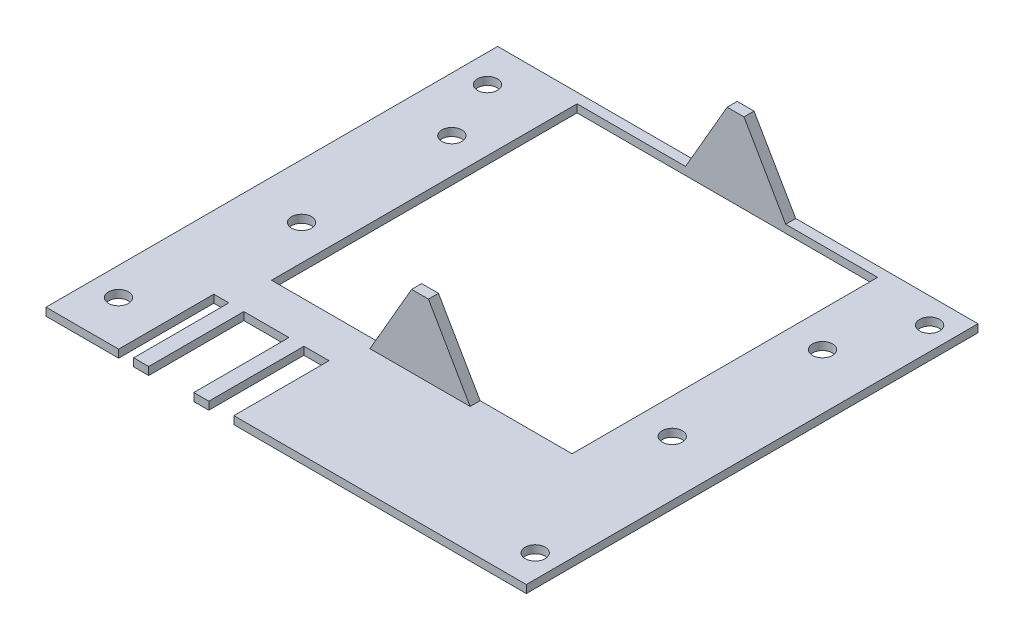
from build123d import *

# Parameters (mm, degrees)
SKETCH1_W               = 96.89
SKETCH1_H               = 90.17
PCB_DEPTH               = 1.57
SKETCH2_R               = 2
M3_MOUNTING_HOLES_DEPTH = 1.57
SKETCH4_R               = 2
CUT_EXTRUDE1_DEPTH      = 23
BOSS_EXTRUDE2_DEPTH     = 2
BOSS_EXTRUDE3_DEPTH     = 2
SKETCH9_W               = 3
SKETCH9_H               = 19
SKETCH9_W_2             = 9
SKETCH9_W_3             = 5
CUT_EXTRUDE2_DEPTH      = 128.304608561
SKETCH10_W              = 0.5
SKETCH10_H              = 90.17
CUT_EXTRUDE3_DEPTH      = 10
SKETCH11_W              = 60
SKETCH11_H              = 61
CUT_EXTRUDE4_DEPTH      = 10


with BuildPart() as part:
    # Sketch1 → PCB (new body)
    with BuildSketch(Plane(origin=(0, 0, 0), x_dir=(1, 0, 0), z_dir=(0, 1, 0))):
        with Locations((16.200949951, 63.633996534)):
            Rectangle(SKETCH1_W, SKETCH1_H)
    extrude(amount=PCB_DEPTH)

    # Sketch2 → M3 Mounting Holes (cut)
    with BuildSketch(Plane(origin=(0, 1.57, 0), x_dir=(1, 0, 0), z_dir=(0, 1, 0))):
        with Locations((59.565949951, 24.898996534)):
            Circle(SKETCH2_R)
        with Locations((-26.164050049, 27.438996534)):
            Circle(SKETCH2_R)
        with Locations((-26.164050049, 101.098996534)):
            Circle(SKETCH2_R)
        with Locations((59.565949951, 103.638996534)):
            Circle(SKETCH2_R)
    extrude(amount=-M3_MOUNTING_HOLES_DEPTH, mode=Mode.SUBTRACT)

    # Sketch4 → Cut-Extrude1 (cut)
    with BuildSketch(Plane(origin=(0, 1.57, 0), x_dir=(1, 0, 0), z_dir=(0, 1, 0))):
        with Locations((-20.894050049, 88.718996534)):
            Circle(SKETCH4_R)
        with Locations((53.105949951, 88.718996534)):
            Circle(SKETCH4_R)
        with Locations((-20.894050049, 58.718996534)):
            Circle(SKETCH4_R)
        with Locations((53.105949951, 58.718996534)):
            Circle(SKETCH4_R)
    extrude(amount=-CUT_EXTRUDE1_DEPTH, mode=Mode.SUBTRACT)

    # Sketch7 → Boss-Extrude2 (add)
    with BuildSketch(Plane.XY.offset(-45.718996534)):
        Polygon((27.755949951, 1.57), (19.438412086, 15.976398176), (16.073487816, 15.976398176), (7.755949951, 1.57), align=None)
    extrude(amount=BOSS_EXTRUDE2_DEPTH)

    # Sketch8 → Boss-Extrude3 (add)
    with BuildSketch(Plane.XY.offset(-108.718996534)):
        Polygon((27.755949951, 1.57), (19.438412086, 15.976398176), (16.073487816, 15.976398176), (7.755949951, 1.57), align=None)
    extrude(amount=BOSS_EXTRUDE3_DEPTH)

    # Sketch9 → Cut-Extrude2 (cut, through all)
    with BuildSketch(Plane(origin=(0, 1.57, 0), x_dir=(1, 0, 0), z_dir=(0, 1, 0))):
        with Locations((-15.744050049, 28.048996534)):
            Rectangle(SKETCH9_W, SKETCH9_H)
        with Locations((-6.744050049, 28.048996534)):
            Rectangle(SKETCH9_W_2, SKETCH9_H)
        with Locations((3.255949951, 28.048996534)):
            Rectangle(SKETCH9_W_3, SKETCH9_H)
    extrude(amount=-CUT_EXTRUDE2_DEPTH, mode=Mode.SUBTRACT)

    # Sketch10 → Cut-Extrude3 (cut)
    with BuildSketch(Plane(origin=(0, 1.57, 0), x_dir=(1, 0, 0), z_dir=(0, 1, 0))):
        with Locations((-31.994050049, 63.633996534)):
            Rectangle(SKETCH10_W, SKETCH10_H)
        with Locations((64.395949951, 63.633996534)):
            Rectangle(SKETCH10_W, SKETCH10_H)
    extrude(amount=-CUT_EXTRUDE3_DEPTH, mode=Mode.SUBTRACT)

    # Sketch11 → Cut-Extrude4 (cut)
    with BuildSketch(Plane(origin=(0, 1.57, 0), x_dir=(1, 0, 0), z_dir=(0, 1, 0))):
        with Locations((16.105949951, 76.218996534)):
            Rectangle(SKETCH11_W, SKETCH11_H)
    extrude(amount=-CUT_EXTRUDE4_DEPTH, mode=Mode.SUBTRACT)


solid = part.part
